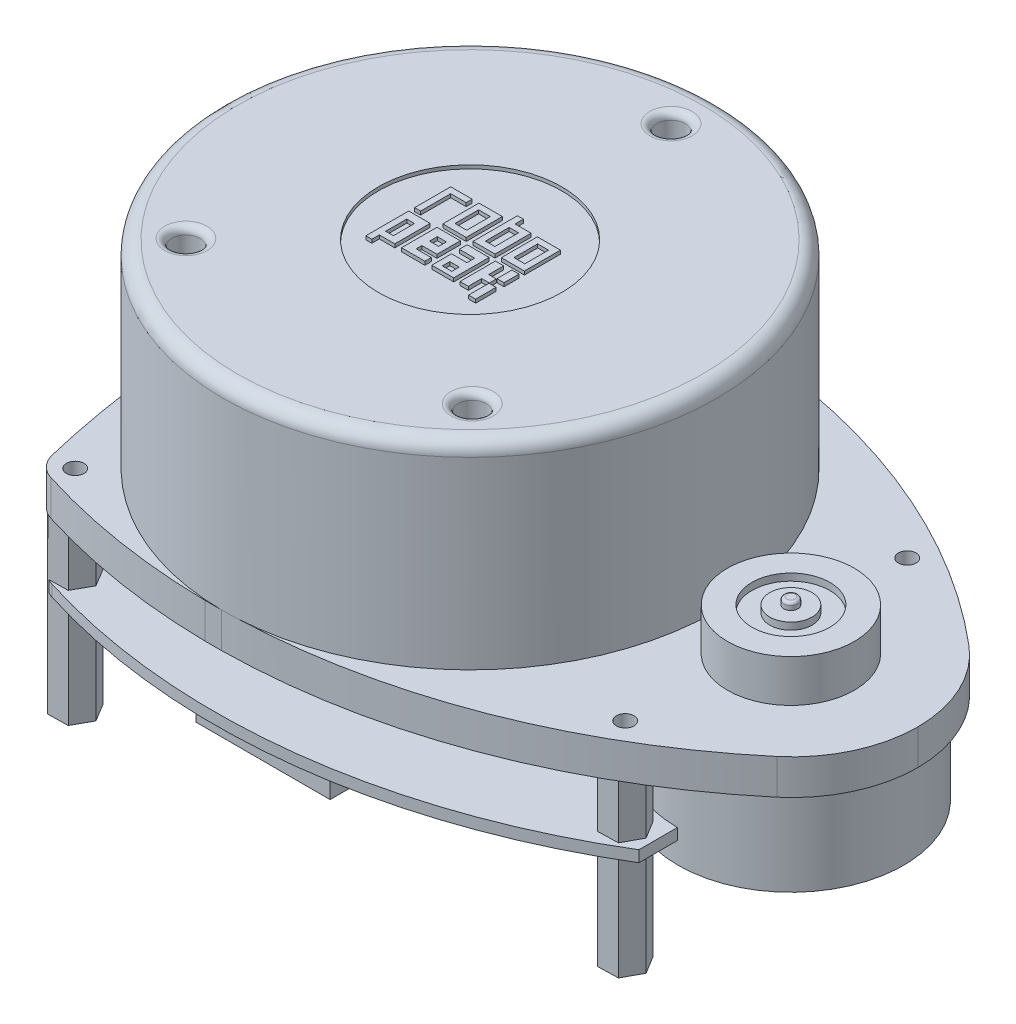
from build123d import *

# Parameters (mm, degrees)
SKETCH_1_W          = 98.5
SKETCH_1_H          = 70
EXTRUDE_1_DEPTH     = 5
SKETCH_2_R          = 35
EXTRUDE_2_DEPTH     = 28.1
SKETCH_3_R          = 2
CUT_EXTRUDE_1_DEPTH = 5
FILLET_1_R          = 2
FILLET_2_R          = 1
SKETCH_4_R          = 13
SKETCH_4_W          = 3.316540618
SKETCH_4_H          = 5.120069114
SKETCH_4_W_2        = 3.276095001
SKETCH_4_W_3        = 1.001370982
SKETCH_4_H_2        = 2.121481923
SKETCH_4_H_3        = 2.893302243
SKETCH_4_W_4        = 1.096399653
SKETCH_4_H_4        = 2.99297568
SKETCH_4_W_5        = 1.536933457
SKETCH_4_H_5        = 3.356986235
SKETCH_4_W_6        = 1.658270309
SKETCH_4_W_7        = 1.334705371
SKETCH_4_H_6        = 1.05158605
SKETCH_4_W_8        = 1.294259754
SKETCH_4_H_7        = 1.092031667
CUT_EXTRUDE_3_DEPTH = 0.5
SKETCH_5_R          = 1.25
CUT_EXTRUDE_4_DEPTH = 5
SKETCH_6_R          = 9
EXTRUDE_3_DEPTH     = 7
CUT_EXTRUDE_START   = -1
SKETCH_7_R          = 9
SKETCH_7_R_2        = 0.99350654
CUT_EXTRUDE_5_DEPTH = 1
SKETCH_8_R          = 5.521677929
SKETCH_8_R_2        = 3.001097475
CUT_EXTRUDE_6_DEPTH = 1
FILLET_3_R          = 0.4
SKETCH_9_R          = 16
EXTRUDE_4_DEPTH     = 18
EXTRUDE_5_DEPTH     = 24.6
SKETCH_11_R         = 26
EXTRUDE_6_DEPTH     = 8
FILLET_4_R          = 1
SKETCH_12_W         = 106.251501727
SKETCH_12_H         = 75.565901032
CUT_EXTRUDE_7_DEPTH = 8
FILLET_5_R          = 100
EXTRUDE_START       = 8
EXTRUDE_7_DEPTH     = 1.6
SKETCH_14_W         = 20
SKETCH_14_H         = 5
EXTRUDE_8_DEPTH     = 6
CHAMFER_1_SIZE      = 1


with BuildPart() as part:
    # Эскиз1 → Бобышка-Вытянуть1 (new body)
    with BuildSketch(Plane(origin=(0, 0, 0), x_dir=(1, 0, 0), z_dir=(0, 1, 0))):
        Rectangle(SKETCH_1_W, SKETCH_1_H)
    extrude(amount=EXTRUDE_1_DEPTH)

    # Эскиз2 → Бобышка-Вытянуть2 (add)
    with BuildSketch(Plane(origin=(0, 5, 0), x_dir=(1, 0, 0), z_dir=(0, 1, 0))):
        with Locations(Location((-14.25, 0, 0), (0, 0, 270))):
            Circle(SKETCH_2_R)
    extrude(amount=EXTRUDE_2_DEPTH)

    # Эскиз3 → Вырез-Вытянуть1 (cut)
    with BuildSketch(Plane(origin=(0, 33.1, 0), x_dir=(1, 0, 0), z_dir=(0, 1, 0))):
        with Locations(Location((-14.25, 28.5, 0), (0, 0, 270))):
            Circle(SKETCH_3_R)
        with Locations(Location((-34.553940504, -20, 0), (0, 0, 270))):
            Circle(SKETCH_3_R)
        with Locations(Location((6.053940504, -20, 0), (0, 0, 270))):
            Circle(SKETCH_3_R)
    extrude(amount=-CUT_EXTRUDE_1_DEPTH, mode=Mode.SUBTRACT)

    # Скругление1
    fillet_1_edges = [part.edges().sort_by_distance(p)[0] for p in [
        (-14.25, 33.1, -35),
    ]]
    fillet(fillet_1_edges, radius=FILLET_1_R)

    # Скругление2
    fillet_2_edges = [part.edges().sort_by_distance(p)[0] for p in [
        (-14.25, 33.1, -30.5),
        (-34.553940504, 33.1, 18),
        (6.053940504, 33.1, 18),
    ]]
    fillet(fillet_2_edges, radius=FILLET_2_R)

    # Эскиз4 → Вырез-Вытянуть3 (cut)
    # profile 1 of 7: a face of its own
    with BuildSketch(Plane(origin=(0, 33.1, 0), x_dir=(1, 0, 0), z_dir=(0, 1, 0))):
        with Locations(Location((-14.25, 0, 0), (0, 0, 270))):
            Circle(SKETCH_4_R)
        Polygon((-22.115166942, -6.914876839), (-22.115166942, -0.831627154), (-19.0735421, -0.831627154), (-19.0735421, -5.853844917), (-21.266341405, -5.853844917), (-21.266341405, -6.914876839), align=None, mode=Mode.SUBTRACT)
        Polygon((-22.115166942, 0), (-22.115166942, 5.120069114), (-19.0735421, 5.120069114), (-19.0735421, 4.27071115), (-21.266341405, 4.27071115), (-21.266341405, 0), align=None, mode=Mode.SUBTRACT)
        Polygon((-13.829606569, 0), (-13.829606569, 6.292992015), (-12.980248606, 6.292992015), (-12.980248606, 5.120069114), (-10.715294037, 5.120069114), (-10.715294037, 0), align=None, mode=Mode.SUBTRACT)
        with Locations((-16.458571693, 2.560034557)):
            Rectangle(SKETCH_4_W, SKETCH_4_H, mode=Mode.SUBTRACT)
        with Locations((-8.187442955, 2.560034557)):
            Rectangle(SKETCH_4_W_2, SKETCH_4_H, mode=Mode.SUBTRACT)
        with Locations((-7.050080946, -1.825090787)):
            Rectangle(SKETCH_4_W_3, SKETCH_4_H_2, mode=Mode.SUBTRACT)
        with Locations((-7.050080946, -5.468225718)):
            Rectangle(SKETCH_4_W_3, SKETCH_4_H_3, mode=Mode.SUBTRACT)
        Polygon((-9.825490456, -0.831627154), (-8.643651064, -0.831627154), (-8.643651064, -2.960833634), (-7.550766437, -2.960833634), (-7.550766437, -3.957287265), (-8.643651064, -3.957287265), (-8.643651064, -5.853844917), (-9.825490456, -5.853844917), align=None, mode=Mode.SUBTRACT)
        Polygon((-13.829606569, -0.831627154), (-10.715294037, -0.831627154), (-10.715294037, -5.853844917), (-13.829606569, -5.853844917), (-13.829606569, -3.04994558), (-11.645543235, -3.04994558), (-11.645543235, -1.940786367), (-13.829606569, -1.940786367), align=None, mode=Mode.SUBTRACT)
        Polygon((-18.116842002, -0.831627154), (-14.800301384, -0.831627154), (-14.800301384, -4.141977247), (-16.943919101, -4.141977247), (-16.943919101, -4.950889593), (-14.800301384, -4.950889593), (-14.800301384, -5.853844917), (-18.116842002, -5.853844917), align=None, mode=Mode.SUBTRACT)
    # profile 2 of 7: a face of its own
    with BuildSketch(Plane(origin=(0, 33.1, 0), x_dir=(1, 0, 0), z_dir=(0, 1, 0))):
        with Locations((-20.718141579, -3.454401753)):
            Rectangle(SKETCH_4_W_4, SKETCH_4_H_4)
    # profile 3 of 7: a face of its own
    with BuildSketch(Plane(origin=(0, 33.1, 0), x_dir=(1, 0, 0), z_dir=(0, 1, 0))):
        with Locations((-8.167220148, 2.592218033)):
            Rectangle(SKETCH_4_W_5, SKETCH_4_H_5)
    # profile 4 of 7: a face of its own
    with BuildSketch(Plane(origin=(0, 33.1, 0), x_dir=(1, 0, 0), z_dir=(0, 1, 0))):
        with Locations((-16.478794502, 2.592218033)):
            Rectangle(SKETCH_4_W_6, SKETCH_4_H_5)
    # profile 5 of 7: a face of its own
    with BuildSketch(Plane(origin=(0, 33.1, 0), x_dir=(1, 0, 0), z_dir=(0, 1, 0))):
        with Locations((-12.312895921, 2.592218033)):
            Rectangle(SKETCH_4_W_7, SKETCH_4_H_5)
    # profile 6 of 7: a face of its own
    with BuildSketch(Plane(origin=(0, 33.1, 0), x_dir=(1, 0, 0), z_dir=(0, 1, 0))):
        with Locations((-12.312895921, -4.667770272)):
            Rectangle(SKETCH_4_W_7, SKETCH_4_H_6)
    # profile 7 of 7: a face of its own
    with BuildSketch(Plane(origin=(0, 33.1, 0), x_dir=(1, 0, 0), z_dir=(0, 1, 0))):
        with Locations((-16.296789224, -2.503929746)):
            Rectangle(SKETCH_4_W_8, SKETCH_4_H_7)
    extrude(amount=-CUT_EXTRUDE_3_DEPTH, mode=Mode.SUBTRACT)

    # Эскиз5 → Вырез-Вытянуть4 (cut)
    with BuildSketch(Plane(origin=(0, 5, 0), x_dir=(1, 0, 0), z_dir=(0, 1, 0))):
        with Locations(Location((-42.25, 28, 0), (0, 0, 270))):
            Circle(SKETCH_5_R)
        with Locations(Location((27.75, 20, 0), (0, 0, 270))):
            Circle(SKETCH_5_R)
        with Locations(Location((27.75, -20, 0), (0, 0, 90))):
            Circle(SKETCH_5_R)
        with Locations(Location((-42.25, -28, 0), (0, 0, 90))):
            Circle(SKETCH_5_R)
    extrude(amount=-CUT_EXTRUDE_4_DEPTH, mode=Mode.SUBTRACT)

    # Эскиз6 → Бобышка-Вытянуть3 (add)
    with BuildSketch(Plane(origin=(0, 5, 0), x_dir=(1, 0, 0), z_dir=(0, 1, 0))):
        with Locations(Location((31.25, 0, 0), (0, 0, 270))):
            Circle(SKETCH_6_R)
    extrude(amount=EXTRUDE_3_DEPTH)

    # Эскиз7 → Вырез-Вытянуть5 (cut)
    with BuildSketch(Plane(origin=(0, 12, 0), x_dir=(1, 0, 0), z_dir=(0, 1, 0)).offset(CUT_EXTRUDE_START)):
        with Locations(Location((31.25, 0, 0), (0, 0, 270))):
            Circle(SKETCH_7_R)
        with Locations(Location((31.25, 0, 0), (0, 0, 270))):
            Circle(SKETCH_7_R_2, mode=Mode.SUBTRACT)
    extrude(amount=CUT_EXTRUDE_5_DEPTH, mode=Mode.SUBTRACT)

    # Эскиз8 → Вырез-Вытянуть6 (cut)
    with BuildSketch(Plane(origin=(0, 11, 0), x_dir=(1, 0, 0), z_dir=(0, 1, 0))):
        with Locations(Location((31.25, 0, 0), (0, 0, 270))):
            Circle(SKETCH_8_R)
        with Locations(Location((31.25, 0, 0), (0, 0, 270))):
            Circle(SKETCH_8_R_2, mode=Mode.SUBTRACT)
    extrude(amount=-CUT_EXTRUDE_6_DEPTH, mode=Mode.SUBTRACT)

    # Скругление3
    fillet_3_edges = [part.edges().sort_by_distance(p)[0] for p in [
        (31.25, 12, -0.99350654),
    ]]
    fillet(fillet_3_edges, radius=FILLET_3_R)

    # Эскиз9 → Бобышка-Вытянуть4 (add)
    with BuildSketch(Plane(origin=(0, 5, 0), x_dir=(1, 0, 0), z_dir=(0, 1, 0))):
        with Locations(Location((31.25, 0, 0), (0, 0, 270))):
            Circle(SKETCH_9_R)
    extrude(amount=-EXTRUDE_4_DEPTH)

    # Эскиз10 → Бобышка-Вытянуть5 (add)
    with BuildSketch(Plane.XZ):
        Polygon((-40.854614908, 25.472900125), (-39.363774764, 27.944889), (-40.759159856, 30.471988875), (-43.645385092, 30.527099875), (-45.136225236, 28.055111), (-43.740840144, 25.528011125), align=None)
        Polygon((29.257133708, 22.462088812), (26.371335397, 22.536260484), (24.864201688, 20.074171672), (26.242866292, 17.537911188), (29.128664603, 17.463739516), (30.635798312, 19.925828328), align=None)
        Polygon((30.635798312, -19.925828328), (29.257133708, -22.462088812), (26.371335397, -22.536260484), (24.864201688, -20.074171672), (26.242866292, -17.537911188), (29.128664603, -17.463739516), align=None)
        Polygon((-43.740840144, -25.528011125), (-40.854614908, -25.472900125), (-39.363774764, -27.944889), (-40.759159856, -30.471988875), (-43.645385092, -30.527099875), (-45.136225236, -28.055111), align=None)
    extrude(amount=EXTRUDE_5_DEPTH)

    # Эскиз11 → Бобышка-Вытянуть6 (add)
    with BuildSketch(Plane(origin=(0, 5, 0), x_dir=(1, 0, 0), z_dir=(0, 1, 0))):
        with Locations(Location((-14.25, 0, 0), (0, 0, 270))):
            Circle(SKETCH_11_R)
    extrude(amount=-EXTRUDE_6_DEPTH)

    # Скругление4
    fillet_4_edges = [part.edges().sort_by_distance(p)[0] for p in [
        (-14.25, -3, -26),
    ]]
    fillet(fillet_4_edges, radius=FILLET_4_R)

    # Эскиз12 → Вырез-Вытянуть7 (cut)
    with BuildSketch(Plane(origin=(0, 5, 0), x_dir=(1, 0, 0), z_dir=(0, 1, 0))):
        with Locations((-0.925367694, -0.052186396)):
            Rectangle(SKETCH_12_W, SKETCH_12_H)
        with BuildLine():
            ThreePointArc((-49.25, 0), (-48.116981176, 14.083966884), (-45.528607092, 27.974329531))
            ThreePointArc((-45.528607092, 27.974329531), (-44.561596332, 29.769996926), (-42.834972324, 30.855492545))
            ThreePointArc((-42.834972324, 30.855492545), (2.249574036, 33.221442581), (42.908955543, 13.599293477))
            ThreePointArc((42.908955543, 13.599293477), (47.577997957, 7.498372972), (49.25, 0))
            ThreePointArc((49.25, 0), (47.577997957, -7.498372972), (42.908955543, -13.599293477))
            ThreePointArc((42.908955543, -13.599293477), (2.249574036, -33.221442581), (-42.834972324, -30.855492545))
            ThreePointArc((-42.834972324, -30.855492545), (-44.561596332, -29.769996926), (-45.528607092, -27.974329531))
            ThreePointArc((-45.528607092, -27.974329531), (-48.116981176, -14.083966884), (-49.25, 0))
        make_face(mode=Mode.SUBTRACT)
    extrude(amount=-CUT_EXTRUDE_7_DEPTH, mode=Mode.SUBTRACT)

    # Скругление5
    # the kernel refuses this fillet: 100 mm, written as the material it takes off along each edge
    with BuildSketch(Plane(origin=(-49.25, 5, 0), x_dir=(0.06766370453174418, 0, 0.9977081853372963), z_dir=(0, -1, 0))) as fillet_5_piece_1:
        with BuildLine():
            CenterArc((6.776645039, -99.922318338), FILLET_5_R, 87.741474483, 12.276669201)
            ThreePointArc((-10.619357471, -1.44704684), (-5.323940761, -0.618859533), (0, 0))
            ThreePointArc((0, 0), (5.358747467, 0.105631125), (10.717494933, 0))
        make_face()
    extrude(amount=31.793737334, mode=Mode.SUBTRACT)

    # Эскиз13 → Бобышка-Вытянуть7 (add)
    with BuildSketch(Plane.XZ.offset(EXTRUDE_START)):
        with BuildLine():
            Line((31.553634402, 21.860321538), (31.553634402, 16.4))
            ThreePointArc((31.553634402, 16.4), (15.153634402, 0), (31.553634402, -16.4))
            Line((31.553634402, -16.4), (31.553634402, -21.860321538))
            ThreePointArc((31.553634402, -21.860321538), (-4.596615235, -34.347840749), (-42.683124513, -30.855492545))
            ThreePointArc((-42.683124513, -30.855492545), (-44.409748521, -29.769996926), (-45.37675928, -27.974329531))
            ThreePointArc((-45.37675928, -27.974329531), (-47.965133365, -14.083966884), (-49.098152188, 0))
            ThreePointArc((-49.098152188, 0), (-47.965133365, 14.083966884), (-45.37675928, 27.974329531))
            ThreePointArc((-45.37675928, 27.974329531), (-44.409748521, 29.769996926), (-42.683124513, 30.855492545))
            ThreePointArc((-42.683124513, 30.855492545), (-4.596615235, 34.347840749), (31.553634402, 21.860321538))
        make_face()
    extrude(amount=EXTRUDE_7_DEPTH)

    # Эскиз14 → Бобышка-Вытянуть8 (add)
    with BuildSketch(Plane.XZ.offset(9.6)):
        with Locations((-14.098152188, 27.5)):
            Rectangle(SKETCH_14_W, SKETCH_14_H)
    extrude(amount=EXTRUDE_8_DEPTH)

    # Фаска1
    chamfer_1_edges = [part.edges().sort_by_distance(p)[0] for p in [
        (-24.098152188, -12.6, 30),
    ]]
    chamfer(chamfer_1_edges, length=CHAMFER_1_SIZE)


solid = part.part
